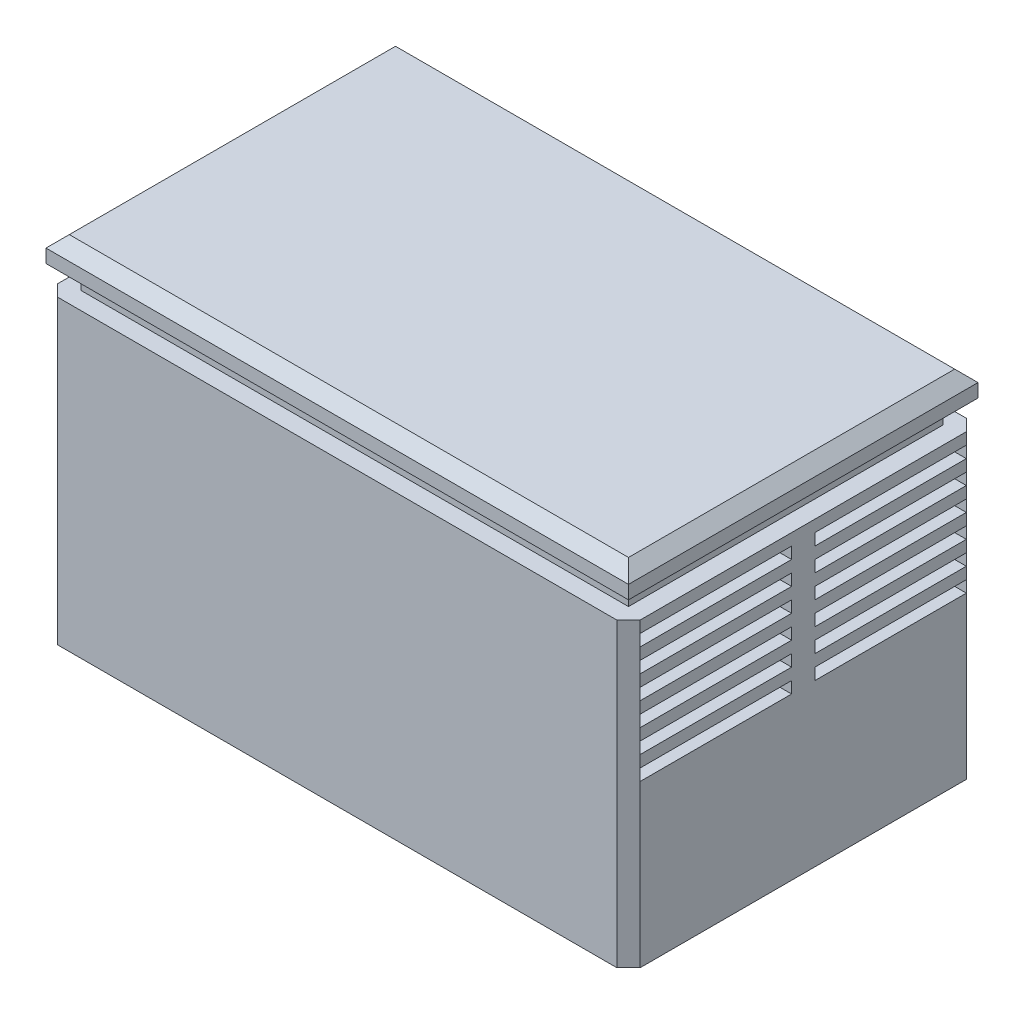
from build123d import *

# Parameters (mm, degrees)
BOSS_EXTRUDE1_DEPTH = 300
SKETCH2_W           = 15
SKETCH2_H           = 10
CUT_EXTRUDE1_DEPTH  = 603.07972894
SKETCH4_W           = 130
SKETCH4_H           = 10
CUT_EXTRUDE2_DEPTH  = 30
SKETCH7_W           = 130
SKETCH7_H           = 10
CUT_EXTRUDE3_DEPTH  = 30
CHAMFER1_SIZE       = 10
CHAMFER2_SIZE       = 10
CHAMFER3_SIZE       = 10


with BuildPart() as part:
    # Sketch1 → Boss-Extrude1 (new body)
    with BuildSketch(Plane.XY):
        Polygon((250, 118.480565371), (235, 118.480565371), (235, 108.480565371), (250, 108.480565371), (250, -150), (-250, -150), (-250, 108.480565371), (-235, 108.480565371), (-235, 118.480565371), (-250, 118.480565371), (-250, 150), (250, 150), align=None)
    extrude(amount=BOSS_EXTRUDE1_DEPTH)

    # Sketch2 → Cut-Extrude1 (cut, through all)
    with BuildSketch(Plane.ZY.offset(250)):
        with Locations((292.5, 113.480565371)):
            Rectangle(SKETCH2_W, SKETCH2_H)
        with Locations((7.5, 113.480565371)):
            Rectangle(SKETCH2_W, SKETCH2_H)
    extrude(amount=-CUT_EXTRUDE1_DEPTH, mode=Mode.SUBTRACT)

    # Sketch4 → Cut-Extrude2 (cut)
    with BuildSketch(Plane.ZY.offset(250)):
        with Locations((75, 93.480565371)):
            Rectangle(SKETCH4_W, SKETCH4_H)
        with Locations((225, 93.480565371)):
            Rectangle(SKETCH4_W, SKETCH4_H)
        with Locations((225, 73.480565371)):
            Rectangle(SKETCH4_W, SKETCH4_H)
        with Locations((225, 53.480565371)):
            Rectangle(SKETCH4_W, SKETCH4_H)
        with Locations((225, 33.480565371)):
            Rectangle(SKETCH4_W, SKETCH4_H)
        with Locations((225, 13.480565371)):
            Rectangle(SKETCH4_W, SKETCH4_H)
        with Locations((225, -6.519434629)):
            Rectangle(SKETCH4_W, SKETCH4_H)
        with Locations((75, 73.480565371)):
            Rectangle(SKETCH4_W, SKETCH4_H)
        with Locations((75, 53.480565371)):
            Rectangle(SKETCH4_W, SKETCH4_H)
        with Locations((75, 33.480565371)):
            Rectangle(SKETCH4_W, SKETCH4_H)
        with Locations((75, 13.480565371)):
            Rectangle(SKETCH4_W, SKETCH4_H)
        with Locations((75, -6.519434629)):
            Rectangle(SKETCH4_W, SKETCH4_H)
    extrude(amount=-CUT_EXTRUDE2_DEPTH, mode=Mode.SUBTRACT)

    # Sketch7 → Cut-Extrude3 (cut)
    with BuildSketch(Plane(origin=(250, 0, 0), x_dir=(0, 0, -1), z_dir=(1, 0, 0))):
        with Locations((-225, 93.480565371)):
            Rectangle(SKETCH7_W, SKETCH7_H)
        with Locations((-75, 93.480565371)):
            Rectangle(SKETCH7_W, SKETCH7_H)
        with Locations((-75, 73.480565371)):
            Rectangle(SKETCH7_W, SKETCH7_H)
        with Locations((-75, 53.480565371)):
            Rectangle(SKETCH7_W, SKETCH7_H)
        with Locations((-75, 33.480565371)):
            Rectangle(SKETCH7_W, SKETCH7_H)
        with Locations((-75, 13.480565371)):
            Rectangle(SKETCH7_W, SKETCH7_H)
        with Locations((-75, -6.519434629)):
            Rectangle(SKETCH7_W, SKETCH7_H)
        with Locations((-225, 73.480565371)):
            Rectangle(SKETCH7_W, SKETCH7_H)
        with Locations((-225, 53.480565371)):
            Rectangle(SKETCH7_W, SKETCH7_H)
        with Locations((-225, 33.480565371)):
            Rectangle(SKETCH7_W, SKETCH7_H)
        with Locations((-225, 13.480565371)):
            Rectangle(SKETCH7_W, SKETCH7_H)
        with Locations((-225, -6.519434629)):
            Rectangle(SKETCH7_W, SKETCH7_H)
    extrude(amount=-CUT_EXTRUDE3_DEPTH, mode=Mode.SUBTRACT)

    # Chamfer1
    chamfer1_edges = [part.edges().sort_by_distance(p)[0] for p in [
        (0, 150, 0),
        (-250, 150, 150),
        (250, 150, 150),
        (0, 150, 300),
    ]]
    chamfer(chamfer1_edges, length=CHAMFER1_SIZE)

    # Chamfer2
    chamfer2_edges = [part.edges().sort_by_distance(p)[0] for p in [
        (0, 118.480565371, 0),
        (-250, 118.480565371, 150),
        (250, 118.480565371, 150),
        (0, 118.480565371, 300),
    ]]
    chamfer(chamfer2_edges, length=CHAMFER2_SIZE)

    # Chamfer3
    chamfer3_edges = [part.edges().sort_by_distance(p)[0] for p in [
        (250, -20.759717314, 300),
        (250, -20.759717314, 0),
        (-250, -20.759717314, 0),
        (-250, -20.759717314, 300),
    ]]
    chamfer(chamfer3_edges, length=CHAMFER3_SIZE - 0.0001)  # a hair under: the kernel refuses the full size


solid = part.part
